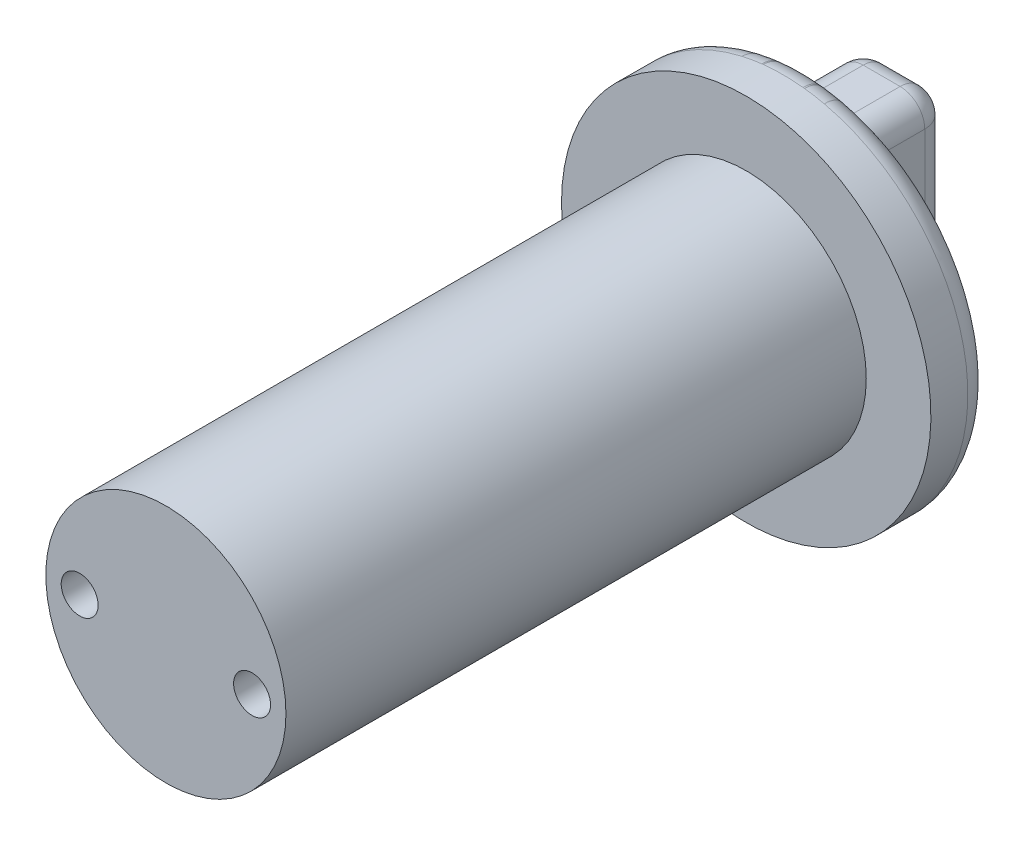
from build123d import *

# Parameters (mm, degrees)
SKETCH1_R           = 9.75
BOSS_EXTRUDE1_DEPTH = 47.125
SKETCH2_R           = 15
BOSS_EXTRUDE2_DEPTH = 5
SKETCH3_W           = 7
SKETCH3_H           = 21.84901374
BOSS_EXTRUDE4_DEPTH = 8
FILLET1_R           = 2
FILLET2_R           = 2
SKETCH4_R           = 1.5
M4_DRILL_DEPTH      = 8


with BuildPart() as part:
    # Sketch1 → Boss-Extrude1 (new body)
    with BuildSketch(Plane.XY):
        Circle(SKETCH1_R)
    extrude(amount=BOSS_EXTRUDE1_DEPTH)

    # Sketch2 → Boss-Extrude2 (add)
    with BuildSketch(Plane(origin=(0, 0, 0), x_dir=(-1, 0, 0), z_dir=(0, 0, -1))):
        Circle(SKETCH2_R)
    extrude(amount=BOSS_EXTRUDE2_DEPTH)

    # Sketch3 → Boss-Extrude4 (add)
    with BuildSketch(Plane(origin=(0, 0, -5), x_dir=(-1, 0, 0), z_dir=(0, 0, -1))):
        Rectangle(SKETCH3_W, SKETCH3_H)
    extrude(amount=BOSS_EXTRUDE4_DEPTH)

    # Fillet1
    fillet1_edges = [part.edges().sort_by_distance(p)[0] for p in [
        (-3.5, 0, -5),
        (-3.5, -10.92450687, -9),
        (0, 10.92450687, -5),
        (-3.5, 10.92450687, -9),
        (3.5, 0, -5),
        (3.5, 10.92450687, -9),
        (0, -10.92450687, -5),
        (3.5, -10.92450687, -9),
        (-3.5, 0, -13),
        (0, 10.92450687, -13),
        (3.5, 0, -13),
        (0, -10.92450687, -13),
    ]]
    fillet(fillet1_edges, radius=FILLET1_R)

    # Fillet2
    # the kernel refuses this fillet: 2 mm, written as the material it takes off along each edge
    with BuildSketch(Plane(origin=(0, 0, -5), x_dir=(-1, 0, 0), z_dir=(0, -1, 0))) as fillet2_piece_1:
        with BuildLine():
            CenterArc((15 - FILLET2_R, -FILLET2_R), FILLET2_R, 0, 90)
            Line((15, -FILLET2_R), (15 + FILLET2_R * 0.02, -FILLET2_R))
            Line((15 + FILLET2_R * 0.02, -FILLET2_R), (15 + FILLET2_R * 0.02, FILLET2_R * 0.02))
            Line((15 + FILLET2_R * 0.02, FILLET2_R * 0.02), (15 - FILLET2_R, FILLET2_R * 0.02))
            Line((15 - FILLET2_R, FILLET2_R * 0.02), (15 - FILLET2_R, 0))
        make_face()
    revolve(axis=Axis((0, 0, -5), (0, 0, -1)), mode=Mode.SUBTRACT)

    # Sketch4 → M4_DRILL (cut)
    with BuildSketch(Plane.XY.offset(47.125)):
        with Locations((-7, 0)):
            Circle(SKETCH4_R)
        with Locations(Location((7, 0, 0), (0, 0, 180))):
            Circle(SKETCH4_R)
    extrude(amount=-M4_DRILL_DEPTH, mode=Mode.SUBTRACT)


solid = part.part
